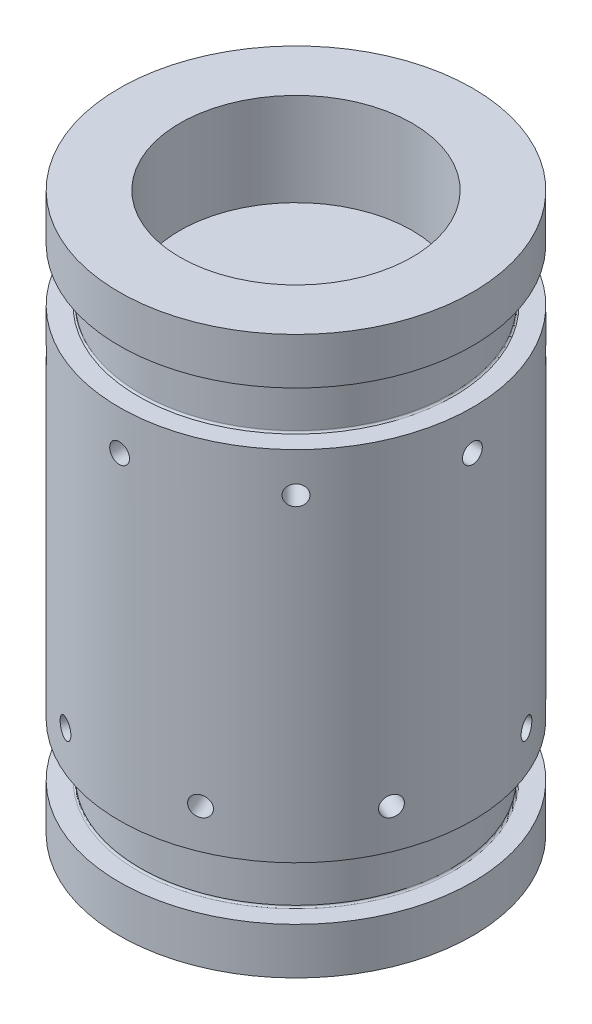
from build123d import *

# Parameters (mm, degrees)
SKETCH1_R                        = 24.1554
BODY_DEPTH                       = 38.1
SKETCH2_R                        = 15.875
LIGHTENING_HOLE_DEPTH            = 12.7
TAPPED_HOLE_PATTERN_COUNT        = 8
F_3_4_0_75_DIAMETER_HOLE1_D      = 19.05
F_3_4_0_75_DIAMETER_HOLE1_DEPTH  = 31.75
F_3_4_0_75_DIAMETER_HOLE1_TIP    = 5.723197396
F_1_4_0_25_DIAMETER_HOLE2_D      = 6.35
F_1_4_0_25_DIAMETER_HOLE2_DEPTH  = 25.4
F_1_4_0_25_DIAMETER_HOLE2_TIP    = 1.907732465
F_3_8_0_375_DIAMETER_HOLE1_D     = 9.525
F_3_8_0_375_DIAMETER_HOLE1_DEPTH = 25.4
F_3_8_0_375_DIAMETER_HOLE1_TIP   = 2.861598698


with BuildPart() as part:
    # Sketch1 → body (new, symmetric)
    with BuildSketch(Plane(origin=(0, 0, 0), x_dir=(1, 0, 0), z_dir=(0, 1, 0))):
        Circle(SKETCH1_R)
    extrude(amount=BODY_DEPTH, both=True)

    # Sketch2 → lightening hole (cut)
    with BuildSketch(Plane(origin=(0, 38.1, 0), x_dir=(1, 0, 0), z_dir=(0, 1, 0))):
        Circle(SKETCH2_R)
    lightening_hole = extrude(amount=-LIGHTENING_HOLE_DEPTH, mode=Mode.SUBTRACT)

    # main-o-ring → o-ring-main (with backup rings) (revolve, cut)
    with BuildSketch(Plane.XY):
        with BuildLine():
            Line((-24.1554, 31.75), (-24.1554, 24.4602))
            Line((-24.1554, 24.4602), (-21.550812385, 24.4602))
            ThreePointArc((-21.550812385, 24.4602), (-21.380956579, 24.530556579), (-21.3106, 24.700412385))
            Line((-21.3106, 24.700412385), (-21.3106, 31.509787615))
            ThreePointArc((-21.3106, 31.509787615), (-21.380956579, 31.679643421), (-21.550812385, 31.75))
            Line((-21.550812385, 31.75), (-24.1554, 31.75))
        make_face()
    o_ring_main_with_backup_rings = revolve(axis=Axis((0, 0, 0), (0, 1, 0)), mode=Mode.SUBTRACT)

    # Top-Bottom Symmetry: lightening hole, o-ring-main (with backup rings) across plane
    add(lightening_hole.mirror(Plane.ZX), mode=Mode.SUBTRACT)
    add(o_ring_main_with_backup_rings.mirror(Plane.ZX), mode=Mode.SUBTRACT)

    # Sketch3 → #6-32 Tapped Hole1 (revolve, cut)
    with BuildSketch(Plane(origin=(-24.1554, 19.05, 0), x_dir=(0, 0, 1), z_dir=(0, 1, 0))):
        Polygon((0, 0), (0, 8.76289403), (1.35255, 7.9502), (1.35255, 0), align=None)
    f_6_32_tapped_hole1 = revolve(axis=Axis((-30.5054, 19.05, 0), (1, 0, 0)), mode=Mode.SUBTRACT)

    # Sketch4 → #6-32 Tapped Hole2 (revolve, cut)
    with BuildSketch(Plane(origin=(-22.31667966, -19.05, -9.243871382), x_dir=(-0.38268343236509006, 0, 0.9238795325112866), z_dir=(0, 1, 0))):
        Polygon((0, 0), (0, 8.76289403), (1.35255, 7.9502), (1.35255, 0), align=None)
    f_6_32_tapped_hole2 = revolve(axis=Axis((-28.183314691, -19.05, -11.673911178), (0.9238795325112866, 0, 0.38268343236509)), mode=Mode.SUBTRACT)

    # Tapped Hole Pattern: #6-32 Tapped Hole1, #6-32 Tapped Hole2 ×8 about axis
    tapped_hole_pattern_axis = Axis((0, 38.1, 0), (0, -1, 0))
    add([f_6_32_tapped_hole1.rotate(tapped_hole_pattern_axis, i * 360 / TAPPED_HOLE_PATTERN_COUNT) for i in range(1, TAPPED_HOLE_PATTERN_COUNT)], mode=Mode.SUBTRACT)
    add([f_6_32_tapped_hole2.rotate(tapped_hole_pattern_axis, i * 360 / TAPPED_HOLE_PATTERN_COUNT) for i in range(1, TAPPED_HOLE_PATTERN_COUNT)], mode=Mode.SUBTRACT)

    # 3/4 (0.75) Diameter Hole1
    with Locations(Plane(origin=(0, 0, -24.1554), x_dir=(-1, 0, 0), z_dir=(0, 0, -1))):
        with Locations((0, 0)):
            Hole(F_3_4_0_75_DIAMETER_HOLE1_D / 2, depth=F_3_4_0_75_DIAMETER_HOLE1_DEPTH)
            with Locations((0, 0, -(F_3_4_0_75_DIAMETER_HOLE1_DEPTH + F_3_4_0_75_DIAMETER_HOLE1_TIP / 2))):  # 118° drill point
                Cone(0, F_3_4_0_75_DIAMETER_HOLE1_D / 2, F_3_4_0_75_DIAMETER_HOLE1_TIP, mode=Mode.SUBTRACT)

    # 1/4 (0.25) Diameter Hole2
    with Locations(Plane(origin=(0, 25.4, 0), x_dir=(1, 0, 0), z_dir=(0, 1, 0))):
        with Locations((0, -12.7)):
            Hole(F_1_4_0_25_DIAMETER_HOLE2_D / 2, depth=F_1_4_0_25_DIAMETER_HOLE2_DEPTH)
            with Locations((0, 0, -(F_1_4_0_25_DIAMETER_HOLE2_DEPTH + F_1_4_0_25_DIAMETER_HOLE2_TIP / 2))):  # 118° drill point
                Cone(0, F_1_4_0_25_DIAMETER_HOLE2_D / 2, F_1_4_0_25_DIAMETER_HOLE2_TIP, mode=Mode.SUBTRACT)

    # 3/8 (0.375) Diameter Hole1
    with Locations(Plane.ZY.offset(24.1554)):
        with Locations((0, 0)):
            Hole(F_3_8_0_375_DIAMETER_HOLE1_D / 2, depth=F_3_8_0_375_DIAMETER_HOLE1_DEPTH)
            with Locations((0, 0, -(F_3_8_0_375_DIAMETER_HOLE1_DEPTH + F_3_8_0_375_DIAMETER_HOLE1_TIP / 2))):  # 118° drill point
                Cone(0, F_3_8_0_375_DIAMETER_HOLE1_D / 2, F_3_8_0_375_DIAMETER_HOLE1_TIP, mode=Mode.SUBTRACT)


solid = part.part
